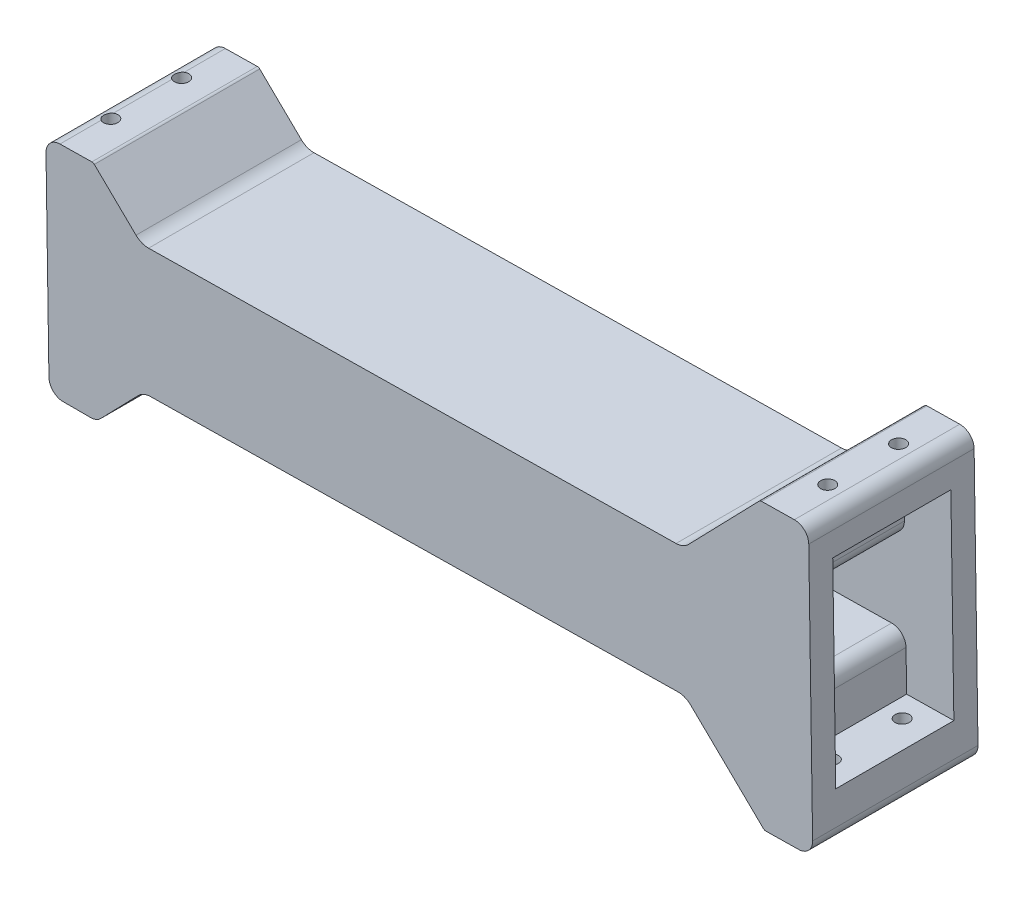
from build123d import *

# Parameters (mm, degrees)
EXTRUDE_1_DEPTH     = 35
SKETCH_2_W          = 25
SKETCH_2_H          = 17
CUT_EXTRUDE_1_DEPTH = 173.018757571
SKETCH_4_W          = 25
SKETCH_4_H          = 13.5
SKETCH_4_H_2        = 11.5
CUT_EXTRUDE_2_DEPTH = 10
SKETCH_7_W          = 25
SKETCH_7_H          = 7
SKETCH_7_H_2        = 6.852029594
CUT_EXTRUDE_5_DEPTH = 10
FILLET_1_R          = 3
SKETCH_9_R          = 1.5
CUT_EXTRUDE_6_DEPTH = 270.810917265
CUT_EXTRUDE_8_DEPTH = 10
FILLET_3_R          = 3


with BuildPart() as part:
    # 草图1 → 凸台-拉伸1 (new body)
    with BuildSketch(Plane.XY):
        with BuildLine():
            Line((107.965790756, 7.914761882), (98.213694846, 7.766808503))
            Line((98.213694846, 7.766808503), (98.92442601, -39.079829993))
            Line((98.92442601, -39.079829993), (108.678766587, -39.079829993))
            ThreePointArc((108.678766587, -39.079829993), (108.959768197, -39.019490003), (109.19628872, -38.856208462))
            Line((109.19628872, -38.856208462), (117.753296763, -30.035556214))
            ThreePointArc((117.753296763, -30.035556214), (118.95311021, -29.207267035), (120.378565842, -28.901176343))
            Line((120.378565842, -28.901176343), (232.012858889, -27.207522891))
            ThreePointArc((232.012858889, -27.207522891), (233.446944009, -27.470230219), (234.671332156, -28.261740759))
            Line((234.671332156, -28.261740759), (250.089839512, -43.21939783))
            ThreePointArc((250.089839512, -43.21939783), (250.331204472, -43.375429159), (250.613907223, -43.427216939))
            Line((250.613907223, -43.427216939), (260.551832391, -43.276444261))
            Line((260.551832391, -43.276444261), (259.64165048, 16.716651749))
            Line((259.64165048, 16.716651749), (249.703725312, 16.565879071))
            ThreePointArc((249.703725312, 16.565879071), (249.422723701, 16.505539082), (249.186203178, 16.34225754))
            Line((249.186203178, 16.34225754), (234.228546108, 0.923750185))
            ThreePointArc((234.228546108, 0.923750185), (233.028732661, 0.095461006), (231.603277029, -0.210629686))
            Line((231.603277029, -0.210629686), (119.968983982, -1.904283139))
            ThreePointArc((119.968983982, -1.904283139), (118.534898862, -1.64157581), (117.310510715, -0.85006527))
            Line((117.310510715, -0.85006527), (108.489858467, 7.706942773))
            ThreePointArc((108.489858467, 7.706942773), (108.248493507, 7.862974102), (107.965790756, 7.914761882))
        make_face()
    extrude(amount=-EXTRUDE_1_DEPTH)

    # 草图2 → 切除-拉伸1 (cut, through all)
    with BuildSketch(Plane(origin=(259.835459196, 3.942079181, 0), x_dir=(0, 0, -1), z_dir=(0.999884933503295, 0.01516969851748372, 0))):
        with Locations((17.5, -17.223957338)):
            Rectangle(SKETCH_2_W, SKETCH_2_H)
    extrude(amount=-CUT_EXTRUDE_1_DEPTH, mode=Mode.SUBTRACT)

    # 草图4 → 切除-拉伸2 (cut)
    with BuildSketch(Plane(origin=(259.835459196, 3.942079181, 0), x_dir=(0, 0, -1), z_dir=(0.999884933503295, 0.01516969851748372, 0))):
        with Locations((17.5, -1.973957338)):
            Rectangle(SKETCH_4_W, SKETCH_4_H)
        with Locations((17.5, -31.473957338)):
            Rectangle(SKETCH_4_W, SKETCH_4_H_2)
    extrude(amount=-CUT_EXTRUDE_2_DEPTH, mode=Mode.SUBTRACT)

    # 草图7 → 切除-拉伸5 (cut)
    with BuildSketch(Plane(origin=(98.308900521, 1.491488003, 0), x_dir=(0, 0, 1), z_dir=(-0.9998849335032951, -0.015169698517482276, 0))):
        with Locations((-17.5, -5.223957338)):
            Rectangle(SKETCH_7_W, SKETCH_7_H)
        with Locations((-17.5, -29.149972135)):
            Rectangle(SKETCH_7_W, SKETCH_7_H_2)
    extrude(amount=-CUT_EXTRUDE_5_DEPTH, mode=Mode.SUBTRACT)

    # 圆角1
    # the kernel refuses this fillet: 3 mm, written as the material it takes off along each edge
    with BuildSketch(Plane(origin=(250.226834538, -21.930615176, -30), x_dir=(0.01516969851748703, -0.9998849335032949, 0), z_dir=(0, 0, 1)), Plane(origin=(249.968949663, -4.932571306, -5), x_dir=(-0.015169698517477554, 0.999884933503295, 0), z_dir=(0, 0, -1))) as fillet_1_piece_1:
        with BuildLine():
            CenterArc((FILLET_1_R, -FILLET_1_R), FILLET_1_R, 90, 90)
            Line((0, -FILLET_1_R), (0, 0))
            Line((0, 0), (FILLET_1_R, 0))
        make_face()
    extrude(amount=25, mode=Mode.SUBTRACT)
    with BuildSketch(Plane(origin=(98.92442601, -39.079829993, 7.387077266), x_dir=(1, 0, 0), z_dir=(0, 0, -1))) as fillet_1_piece_2:
        with BuildLine():
            CenterArc((FILLET_1_R * 0.984943635496, -FILLET_1_R), FILLET_1_R, 90, 89.13080696)
            Line((-FILLET_1_R * 0.0149412980072, -FILLET_1_R * 0.984830301483), (0, 0))
            Line((0, 0), (FILLET_1_R * 0.984943635496, 0))
        make_face()
    extrude(amount=49.774154532, mode=Mode.SUBTRACT)
    with BuildSketch(Plane(origin=(108.678766587, -39.079829993, 3.735844088), x_dir=(0.7926292381316349, 0.6097039370537671, 0), z_dir=(0, 0, -1))) as fillet_1_piece_3:
        with BuildLine():
            CenterArc((1.061212336, -2.968569096), FILLET_1_R, 81.698905724, 45.86919304)
            Line((-0.767899475, -0.590681381), (-0.950810656, -0.35289261))
            Line((-0.950810656, -0.35289261), (-0.182911181, 0.237788771))
            Line((-0.182911181, 0.237788771), (-0.17928295, 0.240536117))
            ThreePointArc((-0.17928295, 0.240536117), (0.589858632, 0.435143228), (1.537650165, 0.29685691))
            Line((1.537650165, 0.29685691), (1.494337635, 0))
        make_face()
    extrude(amount=42.471688176, mode=Mode.SUBTRACT)
    with BuildSketch(Plane(origin=(260.551832391, -43.276444261, 7.5), x_dir=(-0.015169698517487012, 0.9998849335032949, 0), z_dir=(0, 0, -1)), Plane(origin=(98.213694846, 7.766808503, 7.5), x_dir=(0.015169698517482278, -0.999884933503295, 0), z_dir=(0, 0, -1))) as fillet_1_piece_4:
        with BuildLine():
            CenterArc((FILLET_1_R, -FILLET_1_R), FILLET_1_R, 90, 90)
            Line((0, -FILLET_1_R), (0, 0))
            Line((0, 0), (FILLET_1_R, 0))
        make_face()
    extrude(amount=50, mode=Mode.SUBTRACT)
    with BuildSketch(Plane(origin=(259.64165048, 16.716651749, 7.5), x_dir=(0.015169698517487083, -0.9998849335032949, 0), z_dir=(0, 0, -1))) as fillet_1_piece_5:
        with BuildLine():
            CenterArc((FILLET_1_R, FILLET_1_R), FILLET_1_R, 180, 90)
            Line((0, FILLET_1_R), (0, 0))
            Line((0, 0), (FILLET_1_R, 0))
        make_face()
    extrude(amount=50, mode=Mode.SUBTRACT)
    with BuildSketch(Plane(origin=(108.440089659, -7.079768515, -30), x_dir=(0.9998849335032949, 0.015169698517490995, 0), z_dir=(0, 0, 1)), Plane(origin=(108.697974533, -24.077812384, -5), x_dir=(0.9998849335032949, 0.015169698517490636, 0), z_dir=(0, 0, -1))) as fillet_1_piece_6:
        with BuildLine():
            CenterArc((FILLET_1_R, FILLET_1_R), FILLET_1_R, 180, 90)
            Line((0, FILLET_1_R), (0, 0))
            Line((0, 0), (FILLET_1_R, 0))
        make_face()
    extrude(amount=25, mode=Mode.SUBTRACT)

    # 草图9 → 切除-拉伸6 (cut, through all)
    with BuildSketch(Plane(origin=(0.716373196, -47.218523443, 0), x_dir=(0.999884933503295, 0.015169698517483048, 0), z_dir=(0.015169698517483048, -0.999884933503295, 0))):
        with Locations((253.92629217, -25)):
            Circle(SKETCH_9_R)
        with Locations((253.92629217, -10)):
            Circle(SKETCH_9_R)
        with Locations((102.073432063, -10)):
            Circle(SKETCH_9_R)
        with Locations((102.073432063, -25)):
            Circle(SKETCH_9_R)
    extrude(amount=-CUT_EXTRUDE_6_DEPTH, mode=Mode.SUBTRACT)

    # 草图11 → 切除-拉伸8 (cut)
    with BuildSketch(Plane(origin=(0, 0, -35), x_dir=(-1, 0, 0), z_dir=(0, 0, -1))):
        Polygon((-98.335052434, -0.232270965), (-98.803068421, -31.080750525), (-108.801917756, -30.929053539), (-108.333901769, -0.08057398), align=None)
    extrude(amount=-CUT_EXTRUDE_8_DEPTH, mode=Mode.SUBTRACT)

    # 圆角3
    fillet_3_edges = [part.edges().sort_by_distance(p)[0] for p in [
        (103.334477101, -0.156422473, -35),
        (103.802493089, -31.004902032, -35),
    ]]
    fillet(fillet_3_edges, radius=FILLET_3_R)


solid = part.part
